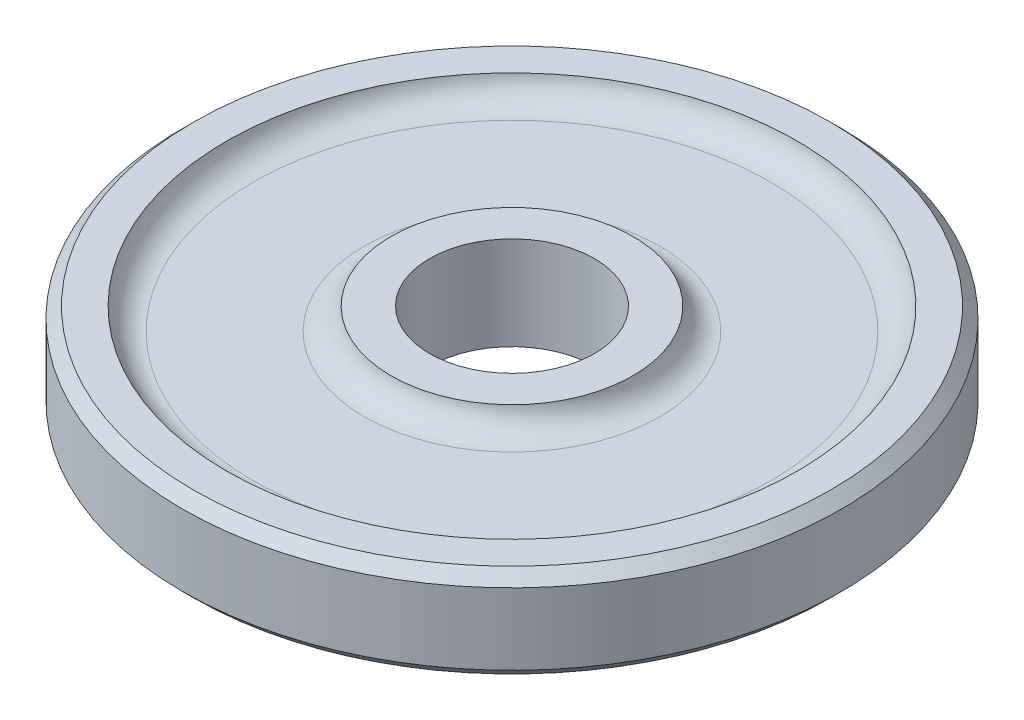
from build123d import *

# Parameters (mm, degrees)
SKETCH1_R           = 60
BOSS_EXTRUDE1_DEPTH = 17
SKETCH2_R           = 52
SKETCH2_R_2         = 22
CUT_EXTRUDE1_DEPTH  = 4
FILLET1_R           = 5
CHAMFER1_SIZE       = 2
SKETCH3_R           = 15
CUT_EXTRUDE2_DEPTH  = 87.539008545


with BuildPart() as part:
    # Sketch1 → Boss-Extrude1 (new body)
    with BuildSketch(Plane(origin=(0, 0, 0), x_dir=(1, 0, 0), z_dir=(0, 1, 0))):
        with Locations(Location((0, 0, 0), (0, 0, 270))):
            Circle(SKETCH1_R)
    extrude(amount=BOSS_EXTRUDE1_DEPTH)

    # Sketch2 → Cut-Extrude1 (cut)
    with BuildSketch(Plane(origin=(0, 17, 0), x_dir=(1, 0, 0), z_dir=(0, 1, 0))):
        with Locations(Location((0, 0, 0), (0, 0, 270))):
            Circle(SKETCH2_R)
        with Locations(Location((0, 0, 0), (0, 0, 270))):
            Circle(SKETCH2_R_2, mode=Mode.SUBTRACT)
    cut_extrude1 = extrude(amount=-CUT_EXTRUDE1_DEPTH, mode=Mode.SUBTRACT)

    # Mirror1: Cut-Extrude1 across plane
    add(cut_extrude1.mirror(Plane.ZX.offset(8.5)), mode=Mode.SUBTRACT)

    # Fillet1
    # the kernel refuses this fillet: 5 mm, written as the material it adds along each edge
    with BuildSketch(Plane(origin=(0, 4, 0), x_dir=(0, 0, 1), z_dir=(-1, 0, 0))) as fillet1_piece_1:
        with BuildLine():
            CenterArc((47.101020514, -5), FILLET1_R, 11.536959033, 78.463040967)
            Line((47.101020514, 0), (47.101020514, 0.1))
            Line((47.101020514, 0.1), (52, 0.1))
            Line((52, 0.1), (52.1, 0))
            ThreePointArc((52.1, 0), (52.1, -2), (52.09797959, -3.98))
            Line((52.09797959, -3.98), (52, -4))
        make_face()
    revolve(axis=Axis((0, 4, 0), (0, 1, 0)))
    with BuildSketch(Plane(origin=(0, 4, 0), x_dir=(0, 0, 1), z_dir=(-1, 0, 0))) as fillet1_piece_2:
        with BuildLine():
            CenterArc((26.898979486, -5), FILLET1_R, 90, 78.463040967)
            Line((22, -4), (21.90202041, -3.98))
            ThreePointArc((21.90202041, -3.98), (21.9, -2), (21.9, 0))
            Line((21.9, 0), (22, 0.1))
            Line((22, 0.1), (26.898979486, 0.1))
            Line((26.898979486, 0.1), (26.898979486, 0))
        make_face()
    revolve(axis=Axis((0, 4, 0), (0, 1, 0)))
    with BuildSketch(Plane(origin=(0, 13, 0), x_dir=(0, 0, 1), z_dir=(-1, 0, 0))) as fillet1_piece_3:
        with BuildLine():
            CenterArc((47.101020514, 5), FILLET1_R, 270, 78.463040967)
            Line((47.101020514, 0), (47.101020514, -0.1))
            Line((47.101020514, -0.1), (52, -0.1))
            Line((52, -0.1), (52.1, 0))
            ThreePointArc((52.1, 0), (52.1, 2), (52.09797959, 3.98))
            Line((52.09797959, 3.98), (52, 4))
        make_face()
    revolve(axis=Axis((0, 13, 0), (0, 1, 0)))
    with BuildSketch(Plane(origin=(0, 13, 0), x_dir=(0, 0, 1), z_dir=(-1, 0, 0))) as fillet1_piece_4:
        with BuildLine():
            CenterArc((26.898979486, 5), FILLET1_R, 191.536959033, 78.463040967)
            Line((22, 4), (21.90202041, 3.98))
            ThreePointArc((21.90202041, 3.98), (21.9, 2), (21.9, 0))
            Line((21.9, 0), (22, -0.1))
            Line((22, -0.1), (26.898979486, -0.1))
            Line((26.898979486, -0.1), (26.898979486, 0))
        make_face()
    revolve(axis=Axis((0, 13, 0), (0, 1, 0)))

    # Chamfer1
    chamfer1_edges = [part.edges().sort_by_distance(p)[0] for p in [
        (0, 0, -60),
        (0, 17, -60),
    ]]
    chamfer(chamfer1_edges, length=CHAMFER1_SIZE)

    # Sketch3 → Cut-Extrude2 (cut, through all)
    with BuildSketch(Plane.XZ):
        with Locations(Location((0, 0, 0), (0, 0, 270))):
            Circle(SKETCH3_R)
    extrude(amount=-CUT_EXTRUDE2_DEPTH, mode=Mode.SUBTRACT)


solid = part.part
